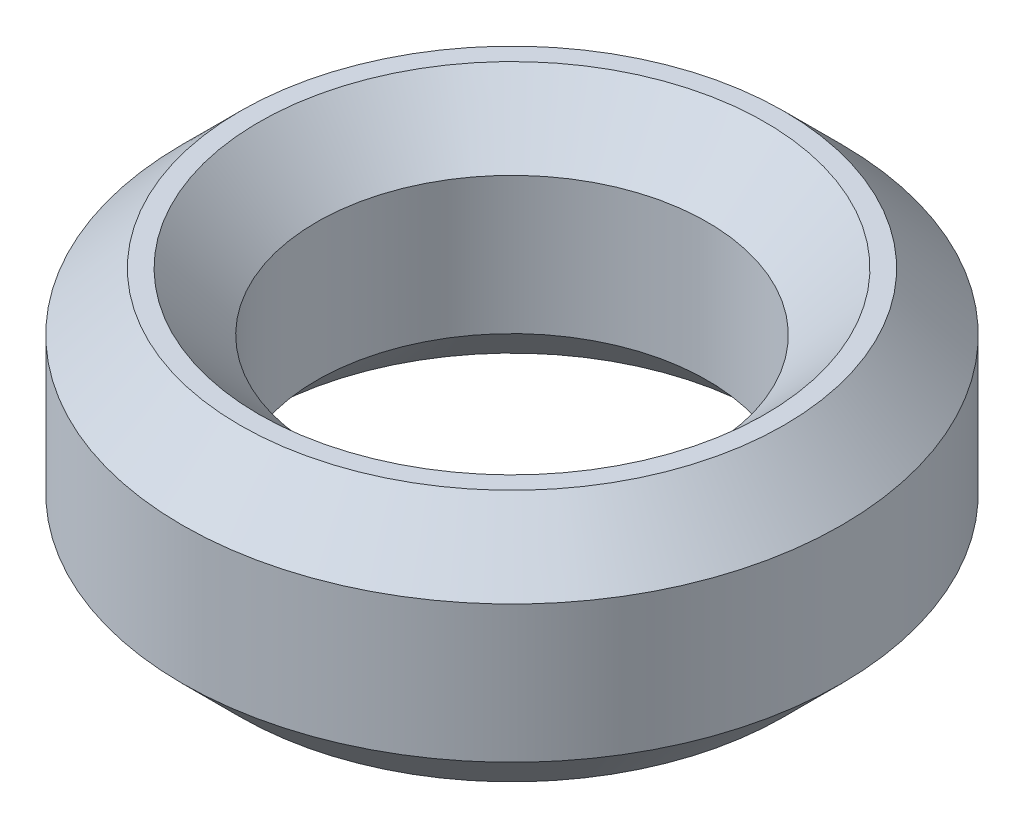
from build123d import *

# Parameters (mm, degrees)
SKETCH1_R           = 17.5
BOSS_EXTRUDE1_DEPTH = 13.40163155
SKETCH2_R           = 10.371156411
CUT_EXTRUDE1_DEPTH  = 29.144337409
CHAMFER1_SIZE       = 3.063112455


with BuildPart() as part:
    # Sketch1 → Boss-Extrude1 (new body)
    with BuildSketch(Plane(origin=(0, 0, 0), x_dir=(1, 0, 0), z_dir=(0, 1, 0))):
        Circle(SKETCH1_R)
    extrude(amount=BOSS_EXTRUDE1_DEPTH)

    # Sketch2 → Cut-Extrude1 (cut, through all)
    with BuildSketch(Plane(origin=(0, 0, 0), x_dir=(1, 0, 0), z_dir=(0, 1, 0))):
        Circle(SKETCH2_R)
    extrude(amount=CUT_EXTRUDE1_DEPTH, mode=Mode.SUBTRACT)

    # Chamfer1
    chamfer1_edges = [part.edges().sort_by_distance(p)[0] for p in [
        (-10.371156411, 13.40163155, 0),
        (-10.371156411, 0, 0),
        (-17.5, 0, 0),
        (-17.5, 13.40163155, 0),
    ]]
    chamfer(chamfer1_edges, length=CHAMFER1_SIZE)


solid = part.part
